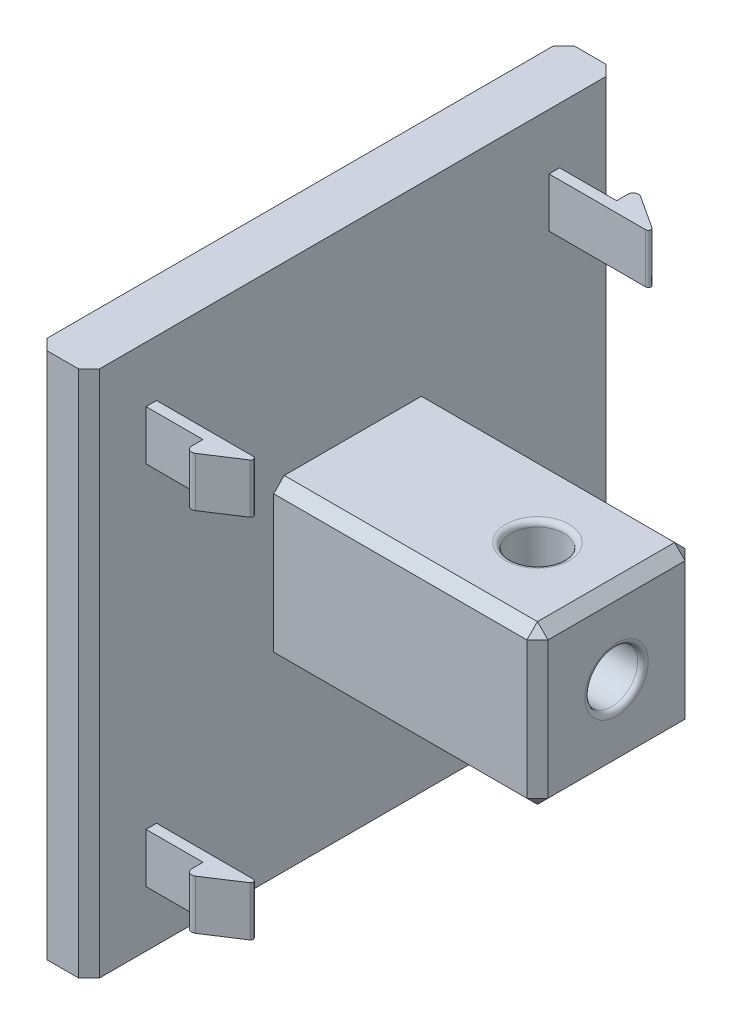
from build123d import *

# Parameters (mm, degrees)
BOSS_EXTRUDE2_DEPTH = 50
SKETCH17_W          = 50
SKETCH17_H          = 5.3
CUT_EXTRUDE5_DEPTH  = 72.414284285
FILLET2_R           = 0.5
SKETCH33_W          = 15
SKETCH33_H          = 15
BOSS_EXTRUDE4_DEPTH = 25
SKETCH34_R          = 2.5
CUT_EXTRUDE13_DEPTH = 4.9
SKETCH37_R          = 2.5
CUT_EXTRUDE14_DEPTH = 4.9
SKETCH38_R          = 2.5
CUT_EXTRUDE15_DEPTH = 4.9
CHAMFER2_SIZE       = 1
FILLET3_R           = 0.5
CHAMFER3_SIZE       = 1
SKETCH40_W          = 10
SKETCH40_H          = 30
CUT_EXTRUDE17_DEPTH = 76
FILLET4_R           = 0.25


with BuildPart() as part:
    # Sketch3 → Boss-Extrude2 (new body)
    with BuildSketch(Plane(origin=(0, 0, 0), x_dir=(1, 0, 0), z_dir=(0, 1, 0))):
        Polygon((5, 44.6), (10.4, 44.6), (10.4, 46.6), (15, 43.6), (5, 43.6), (5, 6.4), (15, 6.4), (10.4, 3.4), (10.4, 5.4), (5, 5.4), (5, 0), (0, 0), (0, 50), (5, 50), align=None)
    extrude(amount=BOSS_EXTRUDE2_DEPTH)

    # Sketch17 → Cut-Extrude5 (cut, through all)
    with BuildSketch(Plane(origin=(5, 0, 0), x_dir=(0, 0, -1), z_dir=(1, 0, 0))):
        with Locations((25, 2.65)):
            Rectangle(SKETCH17_W, SKETCH17_H)
        with Locations((25, 47.35)):
            Rectangle(SKETCH17_W, SKETCH17_H)
    extrude(amount=CUT_EXTRUDE5_DEPTH, mode=Mode.SUBTRACT)

    # Fillet2
    fillet2_edges = [part.edges().sort_by_distance(p)[0] for p in [
        (10.4, 25, -46.6),
        (10.4, 25, -3.4),
    ]]
    fillet(fillet2_edges, radius=FILLET2_R)

    # Sketch33 → Boss-Extrude4 (add)
    with BuildSketch(Plane(origin=(5, 0, 0), x_dir=(0, 0, -1), z_dir=(1, 0, 0))):
        with Locations((25, 25)):
            Rectangle(SKETCH33_W, SKETCH33_H)
    extrude(amount=BOSS_EXTRUDE4_DEPTH)

    # Sketch34 → Cut-Extrude13 (cut)
    with BuildSketch(Plane(origin=(0, 32.5, 0), x_dir=(1, 0, 0), z_dir=(0, 1, 0))):
        with Locations((22.5, 25)):
            Circle(SKETCH34_R)
    extrude(amount=-CUT_EXTRUDE13_DEPTH, mode=Mode.SUBTRACT)

    # Sketch37 → Cut-Extrude14 (cut)
    with BuildSketch(Plane(origin=(30, 0, 0), x_dir=(0, 0, -1), z_dir=(1, 0, 0))):
        with Locations((25, 25)):
            Circle(SKETCH37_R)
    extrude(amount=-CUT_EXTRUDE14_DEPTH, mode=Mode.SUBTRACT)

    # Sketch38 → Cut-Extrude15 (cut)
    with BuildSketch(Plane(origin=(0, 0, -32.5), x_dir=(-1, 0, 0), z_dir=(0, 0, -1))):
        with Locations((-22.5, 25)):
            Circle(SKETCH38_R)
    extrude(amount=-CUT_EXTRUDE15_DEPTH, mode=Mode.SUBTRACT)

    # Chamfer2
    chamfer2_edges = [part.edges().sort_by_distance(p)[0] for p in [
        (17.5, 32.5, -32.5),
        (17.5, 17.5, -32.5),
        (17.5, 17.5, -17.5),
        (17.5, 32.5, -17.5),
        (30, 17.5, -25),
        (30, 25, -32.5),
        (30, 32.5, -25),
        (30, 25, -17.5),
    ]]
    chamfer(chamfer2_edges, length=CHAMFER2_SIZE)

    # Fillet3
    fillet3_edges = [part.edges().sort_by_distance(p)[0] for p in [
        (20, 32.5, -25),
        (30, 25, -22.5),
        (25, 25, -32.5),
    ]]
    fillet(fillet3_edges, radius=FILLET3_R)

    # Chamfer3
    chamfer3_edges = [part.edges().sort_by_distance(p)[0] for p in [
        (5, 25, 0),
        (0, 25, 0),
        (5, 25, -50),
        (0, 25, -50),
    ]]
    chamfer(chamfer3_edges, length=CHAMFER3_SIZE)

    # Sketch40 → Cut-Extrude17 (cut, through all)
    with BuildSketch(Plane(origin=(5, 0, 0), x_dir=(0, 0, -1), z_dir=(1, 0, 0))):
        with Locations((6, 25)):
            Rectangle(SKETCH40_W, SKETCH40_H)
        with Locations((44, 25)):
            Rectangle(SKETCH40_W, SKETCH40_H)
    extrude(amount=CUT_EXTRUDE17_DEPTH, mode=Mode.SUBTRACT)

    # Fillet4
    fillet4_edges = [part.edges().sort_by_distance(p)[0] for p in [
        (15, 42.35, -43.6),
        (15, 42.35, -6.4),
        (15, 7.65, -6.4),
        (15, 7.65, -43.6),
    ]]
    fillet(fillet4_edges, radius=FILLET4_R)


solid = part.part
